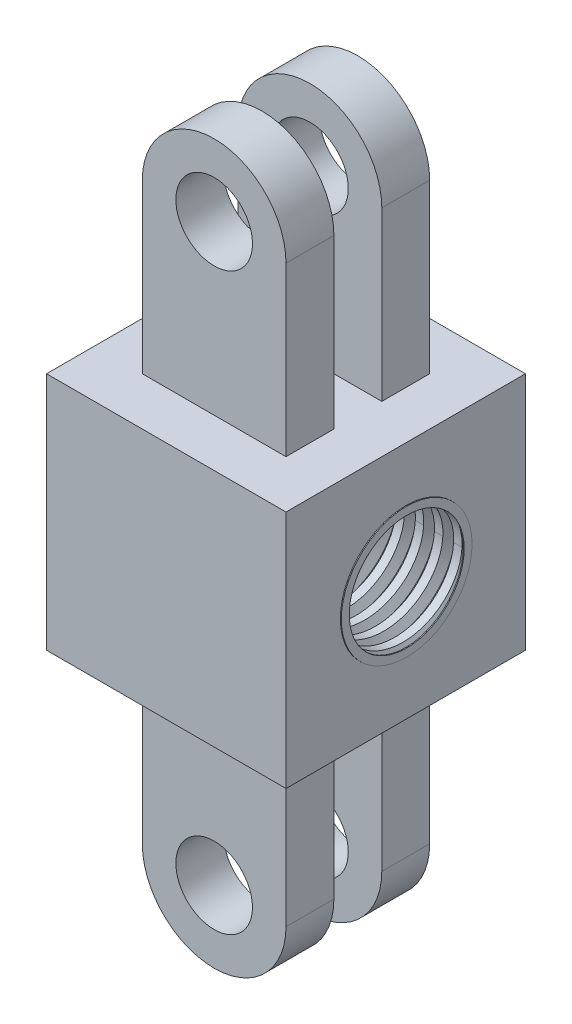
from build123d import *

# Parameters (mm, degrees)
SKETCH1_W           = 25
SKETCH1_H           = 25
BOSS_EXTRUDE1_DEPTH = 25
SKETCH2_W           = 15
SKETCH2_H           = 5
BOSS_EXTRUDE2_DEPTH = 17.5
SKETCH3_R           = 7.5
SKETCH3_R_2         = 4
BOSS_EXTRUDE4_DEPTH = 5
SKETCH4_R           = 4
CUT_EXTRUDE1_DEPTH  = 21.5
BOSS_EXTRUDE5_START = -5
BOSS_EXTRUDE5_DEPTH = 5
MIRROR1_START       = 5
MIRROR1_OUTLINE_R   = 4
MIRROR1_DEPTH       = 5
MIRROR1_START_2     = 15
MIRROR1_2_OUTLINE_R = 4
MIRROR1_2_DEPTH     = 5
SKETCH6_R           = 6
CUT_EXTRUDE2_DEPTH  = 63.5
THREAD2_PITCH       = 2
BOSS_EXTRUDE6_START = 0.1
SKETCH7_R           = 6.825712905
SKETCH7_R_2         = 6
BOSS_EXTRUDE6_DEPTH = 0.1


# Read off the part's stored shape, not the designer's step: Mirror1
with BuildPart() as part:
    # Sketch1 → Boss-Extrude1 (new body)
    with BuildSketch(Plane(origin=(0, 0, 0), x_dir=(1, 0, 0), z_dir=(0, 1, 0))):
        with Locations((12.5, -12.5)):
            Rectangle(SKETCH1_W, SKETCH1_H)
    extrude(amount=BOSS_EXTRUDE1_DEPTH)

    # Sketch2 → Boss-Extrude2 (add)
    with BuildSketch(Plane(origin=(0, 25, 0), x_dir=(1, 0, 0), z_dir=(0, 1, 0))):
        with Locations((12.5, -7.5)):
            Rectangle(SKETCH2_W, SKETCH2_H)
        with Locations((12.5, -17.5)):
            Rectangle(SKETCH2_W, SKETCH2_H)
    extrude(amount=BOSS_EXTRUDE2_DEPTH)

    # Sketch3 → Boss-Extrude4 (add)
    with BuildSketch(Plane.XY.offset(20)):
        with Locations((12.5, 42.5)):
            Circle(SKETCH3_R)
        with Locations((12.5, 42.5)):
            Circle(SKETCH3_R_2, mode=Mode.SUBTRACT)
    extrude(amount=-BOSS_EXTRUDE4_DEPTH)

    # Sketch4 → Cut-Extrude1 (cut)
    with BuildSketch(Plane.XY.offset(20)):
        with Locations((12.5, 42.5)):
            Circle(SKETCH4_R)
    extrude(amount=-CUT_EXTRUDE1_DEPTH, mode=Mode.SUBTRACT)

    # Sketch5 → Boss-Extrude5 (add)
    with BuildSketch(Plane(origin=(0, 0, 5), x_dir=(-1, 0, 0), z_dir=(0, 0, -1)).offset(BOSS_EXTRUDE5_START)):
        with BuildLine():
            ThreePointArc((-16.5, 42.5), (-12.5, 46.5), (-8.5, 42.5))
            Line((-8.5, 42.5), (-5, 42.5))
            ThreePointArc((-5, 42.5), (-12.5, 50), (-20, 42.5))
            Line((-20, 42.5), (-16.5, 42.5))
        make_face()
    extrude(amount=BOSS_EXTRUDE5_DEPTH)

    # Mirror1 outline → Mirror1 (add)
    with BuildSketch(Plane.XY.offset(MIRROR1_START)):
        with BuildLine():
            Line((20, 0), (5, 0))
            Line((5, 0), (5, -17.5))
            ThreePointArc((5, -17.5), (12.5, -25), (20, -17.5))
            Line((20, -17.5), (20, 0))
        make_face()
        with Locations((12.5, -17.5)):
            Circle(MIRROR1_OUTLINE_R, mode=Mode.SUBTRACT)
    extrude(amount=MIRROR1_DEPTH)

    # Mirror1 2 outline → Mirror1 2 (add)
    with BuildSketch(Plane.XY.offset(MIRROR1_START_2)):
        with BuildLine():
            Line((20, 0), (5, 0))
            Line((5, 0), (5, -17.5))
            ThreePointArc((5, -17.5), (12.5, -25), (20, -17.5))
            Line((20, -17.5), (20, 0))
        make_face()
        with Locations((12.5, -17.5)):
            Circle(MIRROR1_2_OUTLINE_R, mode=Mode.SUBTRACT)
    extrude(amount=MIRROR1_2_DEPTH)

    # Sketch6 → Cut-Extrude2 (cut)
    with BuildSketch(Plane(origin=(25, 0, 0), x_dir=(0, 0, -1), z_dir=(1, 0, 0))):
        with Locations((-12.5, 12.5)):
            Circle(SKETCH6_R)
    extrude(amount=-CUT_EXTRUDE2_DEPTH, mode=Mode.SUBTRACT)

    # Thread2: the profile of Thread Profile3 profile screwed along a right-hand helix of 15 turns, 10 arcs to a turn; built about Z, then put on its axis
    thread2_z = Axis((0, 0, 0), (0, 0, 1))
    thread2_corners = [(5.9997, 0, -0.000173205), (6.811898813, 0, 0.468749998), (6.811898813, 0, 0.656249998), (5.9997, 0, 1.125173201)]
    with BuildLine(mode=Mode.PRIVATE) as thread2_profile:
        Line(thread2_corners[0], thread2_corners[1])
        Line(thread2_corners[1], thread2_corners[2])
        Line(thread2_corners[2], thread2_corners[3])
        Line(thread2_corners[3], thread2_corners[0])
    thread2_cap = Face(thread2_profile.wire())
    thread2_turn_angles = [0, 18, 36, 54, 72, 90, 108, 126, 144, 162, 180, 198, 216, 234, 252, 270, 288, 306, 324, 342, 360]
    thread2_turn_weights = [1, 0.9510565162951535, 1, 0.9510565162951535, 1, 0.9510565162951535, 1, 0.9510565162951535, 1, 0.9510565162951535, 1, 0.9510565162951535, 1, 0.9510565162951535, 1, 0.9510565162951535, 1, 0.9510565162951535, 1, 0.9510565162951535, 1]
    thread2_turn_rails = [Edge.make_bspline([Vector(p[0], p[1], 0).rotate(thread2_z, thread2_turn_angles[k]) / thread2_turn_weights[k] + Vector(0, 0, p[2] + THREAD2_PITCH * thread2_turn_angles[k] / 360) for k in range(21)], [0, 0, 0, 1, 1, 2, 2, 3, 3, 4, 4, 5, 5, 6, 6, 7, 7, 8, 8, 9, 9, 10, 10, 10], 2, thread2_turn_weights) for p in thread2_corners]
    thread2_turn_sides = [Face.make_surface_from_curves(thread2_turn_rails[p[0]], thread2_turn_rails[p[1]]) for p in [(0, 1), (1, 2), (2, 3), (3, 0)]]
    thread2 = Plane(origin=(27, 12.5, 12.5), x_dir=(0, 0, 1), z_dir=(-1, 0, 0)) * Solid(Shell([*[p.moved(Location((0, 0, THREAD2_PITCH * i))) for i in range(15) for p in thread2_turn_sides], thread2_cap, thread2_cap.rotate(thread2_z, 5400).moved(Location((0, 0, THREAD2_PITCH * 5400 / 360)))]))
    add(thread2, mode=Mode.SUBTRACT)

    # Sketch7 → Boss-Extrude6 (add)
    with BuildSketch(Plane(origin=(25, 0, 0), x_dir=(0, 0, -1), z_dir=(1, 0, 0)).offset(BOSS_EXTRUDE6_START)):
        with Locations(Location((-12.5, 12.5, 0), (0, 0, 180))):
            Circle(SKETCH7_R)
        with Locations((-12.5, 12.5)):
            Circle(SKETCH7_R_2, mode=Mode.SUBTRACT)
    extrude(amount=-BOSS_EXTRUDE6_DEPTH)


solid = part.part
